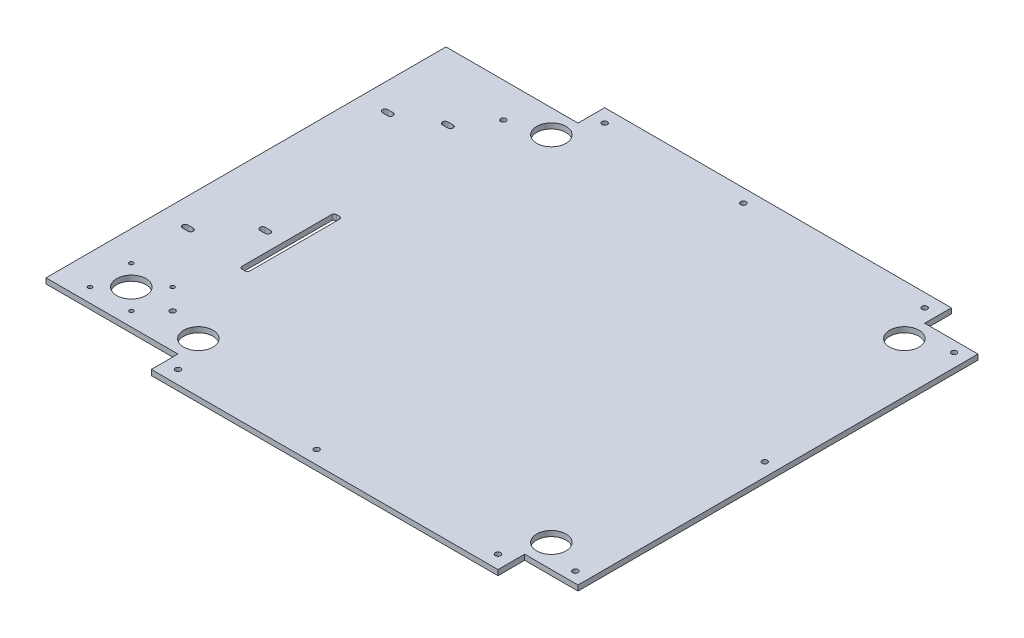
from build123d import *

# Parameters (mm, degrees)
SKETCH1_4_R         = 11
SKETCH1_4_R_2       = 2
SKETCH1_4_R_3       = 1.5
BOSS_EXTRUDE3_DEPTH = 4


with BuildPart() as part:
    # Sketch1<4> → Boss-Extrude3 (new body)
    with BuildSketch(Plane(origin=(0, 0, 0), x_dir=(1, 0, 0), z_dir=(0, 1, 0))):
        Polygon((130, -150), (170, -150), (170, 150), (130, 150), (130, 170), (-130, 170), (-130, 150), (-229, 150), (-229, -150), (-130, -150), (-130, -170), (130, -170), align=None)
        with Locations((132.375, -132.375)):
            Circle(SKETCH1_4_R, mode=Mode.SUBTRACT)
        with Locations((132.375, 132.375)):
            Circle(SKETCH1_4_R, mode=Mode.SUBTRACT)
        with Locations((160, -142)):
            Circle(SKETCH1_4_R_2, mode=Mode.SUBTRACT)
        with Locations((160, 0)):
            Circle(SKETCH1_4_R_2, mode=Mode.SUBTRACT)
        with Locations((160, 142)):
            Circle(SKETCH1_4_R_2, mode=Mode.SUBTRACT)
        with Locations((-132.375, 132.375)):
            Circle(SKETCH1_4_R, mode=Mode.SUBTRACT)
        with BuildLine():
            ThreePointArc((-163, -2), (-162.414213562, -0.585786438), (-161, 0))
            Line((-161, 0), (-159, 0))
            ThreePointArc((-159, 0), (-157.585786438, -0.585786438), (-157, -2))
            Line((-157, -2), (-157, -68.911348687))
            ThreePointArc((-157, -68.911348687), (-157.585786438, -70.325562249), (-159, -70.911348687))
            Line((-159, -70.911348687), (-161, -70.911348687))
            ThreePointArc((-161, -70.911348687), (-162.414213562, -70.325562249), (-163, -68.911348687))
            Line((-163, -68.911348687), (-163, -2))
        make_face(mode=Mode.SUBTRACT)
        with Locations((-160, 124)):
            Circle(SKETCH1_4_R_2, mode=Mode.SUBTRACT)
        with Locations((-132.375, -132.375)):
            Circle(SKETCH1_4_R, mode=Mode.SUBTRACT)
        with Locations((-160, -124)):
            Circle(SKETCH1_4_R_2, mode=Mode.SUBTRACT)
        with Locations((-16, -160)):
            Circle(SKETCH1_4_R_2, mode=Mode.SUBTRACT)
        with Locations((120, -160)):
            Circle(SKETCH1_4_R_2, mode=Mode.SUBTRACT)
        with Locations((-120, -160)):
            Circle(SKETCH1_4_R_2, mode=Mode.SUBTRACT)
        with Locations((-206.5, -108.5)):
            Circle(SKETCH1_4_R_3, mode=Mode.SUBTRACT)
        with Locations((-175.5, -108.5)):
            Circle(SKETCH1_4_R_3, mode=Mode.SUBTRACT)
        with Locations((-206.5, -139.5)):
            Circle(SKETCH1_4_R_3, mode=Mode.SUBTRACT)
        with Locations((-175.5, -139.5)):
            Circle(SKETCH1_4_R_3, mode=Mode.SUBTRACT)
        with Locations((-191, -124)):
            Circle(SKETCH1_4_R, mode=Mode.SUBTRACT)
        with BuildLine():
            ThreePointArc((-210.1, -66.5), (-212.1, -64.5), (-210.1, -62.5))
            Line((-210.1, -62.5), (-206.1, -62.5))
            ThreePointArc((-206.1, -62.5), (-204.1, -64.5), (-206.1, -66.5))
            Line((-206.1, -66.5), (-210.1, -66.5))
        make_face(mode=Mode.SUBTRACT)
        with BuildLine():
            ThreePointArc((-179.6, -39), (-181.6, -37), (-179.6, -35))
            Line((-179.6, -35), (-175.6, -35))
            ThreePointArc((-175.6, -35), (-173.6, -37), (-175.6, -39))
            Line((-175.6, -39), (-179.6, -39))
        make_face(mode=Mode.SUBTRACT)
        with BuildLine():
            ThreePointArc((-210.1, 83.4), (-212.1, 85.4), (-210.1, 87.4))
            Line((-210.1, 87.4), (-206.1, 87.4))
            ThreePointArc((-206.1, 87.4), (-204.1, 85.4), (-206.1, 83.4))
            Line((-206.1, 83.4), (-210.1, 83.4))
        make_face(mode=Mode.SUBTRACT)
        with BuildLine():
            ThreePointArc((-179.6, 98), (-181.6, 100), (-179.6, 102))
            Line((-179.6, 102), (-175.6, 102))
            ThreePointArc((-175.6, 102), (-173.6, 100), (-175.6, 98))
            Line((-175.6, 98), (-179.6, 98))
        make_face(mode=Mode.SUBTRACT)
        with Locations((-16, 160)):
            Circle(SKETCH1_4_R_2, mode=Mode.SUBTRACT)
        with Locations((120, 160)):
            Circle(SKETCH1_4_R_2, mode=Mode.SUBTRACT)
        with Locations((-120, 160)):
            Circle(SKETCH1_4_R_2, mode=Mode.SUBTRACT)
    extrude(amount=BOSS_EXTRUDE3_DEPTH)


solid = part.part
